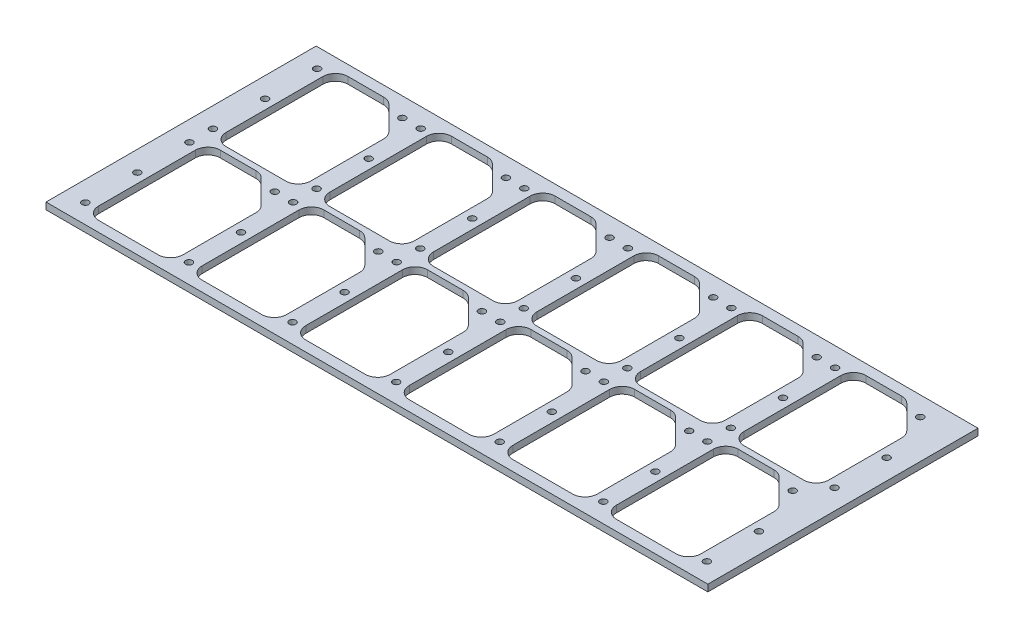
from build123d import *

# Parameters (mm, degrees)
SKETCH1_W            = 622.3
SKETCH1_H            = 254
BOSS_EXTRUDE1_DEPTH  = 6.35
CUT_EXTRUDE1_DEPTH   = 337.130398804
LPATTERN1_COUNT      = 6
LPATTERN1_PITCH      = 97.4
LPATTERN1_COUNT_DIR2 = 2
LPATTERN1_PITCH_DIR2 = 120
SKETCH3_R            = 3.175
CUT_EXTRUDE2_DEPTH   = 337.130398804
LPATTERN2_COUNT      = 6
LPATTERN2_PITCH      = 97.4
LPATTERN2_COUNT_DIR2 = 2
LPATTERN2_PITCH_DIR2 = 120


with BuildPart() as part:
    # Sketch1 → Boss-Extrude1 (new body)
    with BuildSketch(Plane(origin=(0, 0, 0), x_dir=(1, 0, 0), z_dir=(0, 1, 0))):
        Rectangle(SKETCH1_W, SKETCH1_H)
    extrude(amount=BOSS_EXTRUDE1_DEPTH)

    # Sketch2 → Cut-Extrude1 (cut, through all)
    with BuildSketch(Plane(origin=(0, 6.35, 0), x_dir=(1, 0, 0), z_dir=(0, 1, 0))):
        with BuildLine():
            Line((-207.22685066, -28.590811691), (-229.590811691, -6.22685066))
            ThreePointArc((-229.590811691, -6.22685066), (-233.386564872, -3.69060947), (-237.863961031, -2.8))
            Line((-237.863961031, -2.8), (-271.5, -2.8))
            ThreePointArc((-271.5, -2.8), (-279.77314934, -6.22685066), (-283.2, -14.5))
            Line((-283.2, -14.5), (-283.2, -105.5))
            ThreePointArc((-283.2, -105.5), (-279.77314934, -113.77314934), (-271.5, -117.2))
            Line((-271.5, -117.2), (-215.5, -117.2))
            ThreePointArc((-215.5, -117.2), (-207.22685066, -113.77314934), (-203.8, -105.5))
            Line((-203.8, -105.5), (-203.8, -36.863961031))
            ThreePointArc((-203.8, -36.863961031), (-204.69060947, -32.386564872), (-207.22685066, -28.590811691))
        make_face()
    cut_extrude1 = extrude(amount=-CUT_EXTRUDE1_DEPTH, mode=Mode.SUBTRACT)

    # LPattern1: Cut-Extrude1 6 × 2
    with Locations(*[(i * LPATTERN1_PITCH, 0, -j * LPATTERN1_PITCH_DIR2) for i in range(LPATTERN1_COUNT) for j in range(LPATTERN1_COUNT_DIR2) if (i, j) != (0, 0)]):
        add(cut_extrude1, mode=Mode.SUBTRACT)

    # Sketch3 → Cut-Extrude2 (cut, through all)
    with BuildSketch(Plane(origin=(0, 6.35, 0), x_dir=(1, 0, 0), z_dir=(0, 1, 0))):
        with Locations((-292.2, 108.955129855)):
            Circle(SKETCH3_R)
        with Locations((-292.2, 11.044870145)):
            Circle(SKETCH3_R)
        with Locations((-212.044870145, 108.955129855)):
            Circle(SKETCH3_R)
        with Locations((-292.2, 60)):
            Circle(SKETCH3_R)
        with Locations((-194.8, 60)):
            Circle(SKETCH3_R)
        with Locations((-194.8, 11.044870145)):
            Circle(SKETCH3_R)
    cut_extrude2 = extrude(amount=-CUT_EXTRUDE2_DEPTH, mode=Mode.SUBTRACT)

    # LPattern2: Cut-Extrude2 6 × 2
    with Locations(*[(i * LPATTERN2_PITCH, 0, j * LPATTERN2_PITCH_DIR2) for i in range(LPATTERN2_COUNT) for j in range(LPATTERN2_COUNT_DIR2) if (i, j) != (0, 0)]):
        add(cut_extrude2, mode=Mode.SUBTRACT)


solid = part.part
